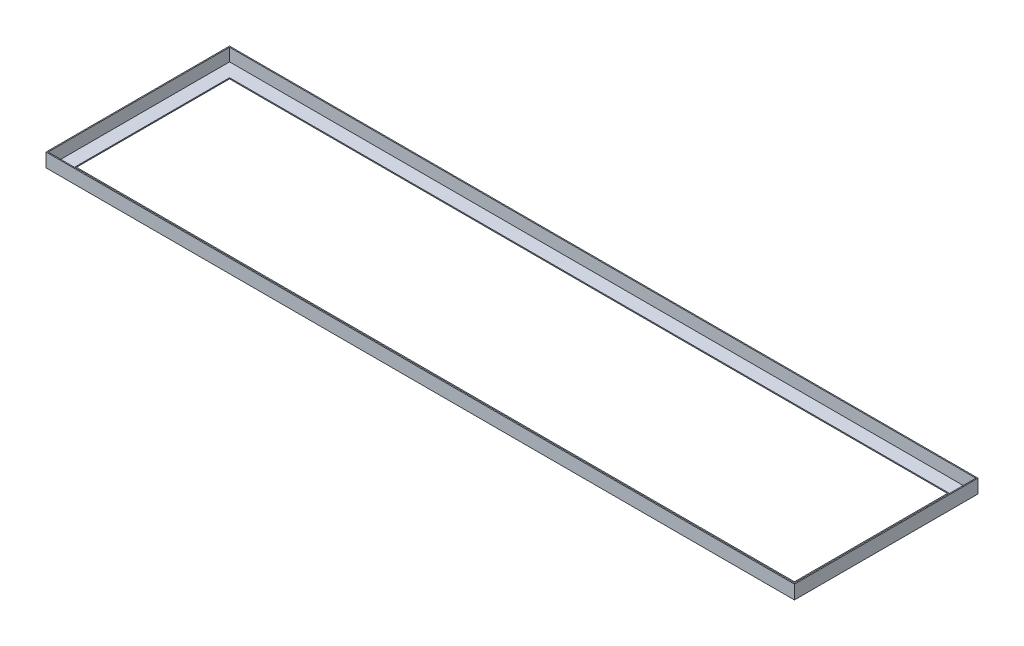
from build123d import *

# Parameters (mm, degrees)
SKETCH1_W           = 2180
SKETCH1_H           = 534.64
SKETCH1_W_2         = 2174
SKETCH1_H_2         = 528.64
BOSS_EXTRUDE1_DEPTH = 40
SKETCH1_3_W         = 2174
SKETCH1_3_H         = 528.64
SKETCH1_3_W_2       = 2094
SKETCH1_3_H_2       = 448.64
BOSS_EXTRUDE2_DEPTH = 3


with BuildPart() as part:
    # Sketch1 → Boss-Extrude1 (new body)
    with BuildSketch(Plane(origin=(0, 0, 0), x_dir=(1, 0, 0), z_dir=(0, 1, 0))):
        Rectangle(SKETCH1_W, SKETCH1_H)
        Rectangle(SKETCH1_W_2, SKETCH1_H_2, mode=Mode.SUBTRACT)
    extrude(amount=BOSS_EXTRUDE1_DEPTH)

    # Sketch1<3> → Boss-Extrude2 (add)
    with BuildSketch(Plane(origin=(0, 0, 0), x_dir=(1, 0, 0), z_dir=(0, 1, 0))):
        Rectangle(SKETCH1_3_W, SKETCH1_3_H)
        Rectangle(SKETCH1_3_W_2, SKETCH1_3_H_2, mode=Mode.SUBTRACT)
    extrude(amount=BOSS_EXTRUDE2_DEPTH)


solid = part.part
